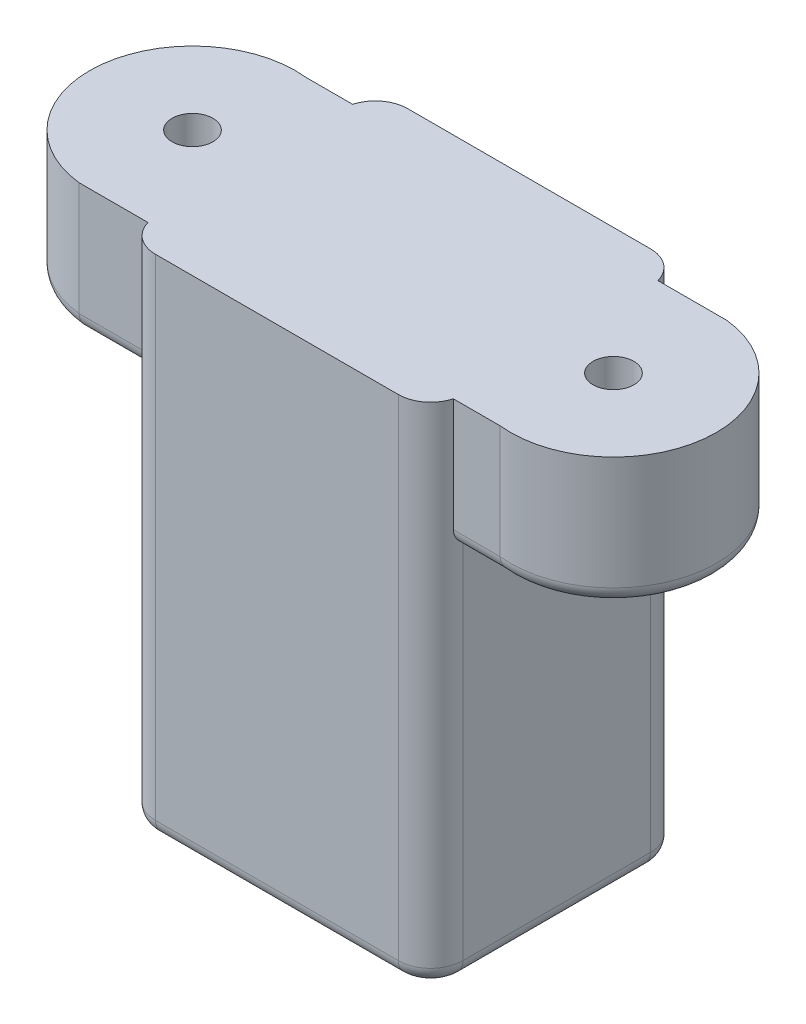
from build123d import *

# Parameters (mm, degrees)
BOSS_EXTRUDE1_DEPTH   = 5.08
M2X0_4_TAPPED_HOLE1_D = 1.6
SKETCH8_W             = 12.065
SKETCH8_H             = 9.8933
BOSS_EXTRUDE2_DEPTH   = 19.8628
FILLET1_R             = 1.27
FILLET2_R             = 0.635
FILLET3_R             = 0.635


with BuildPart() as part:
    # Sketch1 → Boss-Extrude1 (new body)
    with BuildSketch(Plane(origin=(0, 0, 0), x_dir=(1, 0, 0), z_dir=(0, 1, 0))):
        with BuildLine():
            Line((7.823998487, -4.0132), (-8.686001513, -4.0132))
            ThreePointArc((-8.686001513, -4.0132), (-12.2682, 0.431001513), (-7.823998487, 4.0132))
            Line((-7.823998487, 4.0132), (8.686001513, 4.0132))
            ThreePointArc((8.686001513, 4.0132), (12.2682, -0.431001513), (7.823998487, -4.0132))
        make_face()
    extrude(amount=BOSS_EXTRUDE1_DEPTH)

    # M2x0.4 Tapped Hole1 (through all)
    with Locations(Plane(origin=(0, 5.08, 0), x_dir=(1, 0, 0), z_dir=(0, 1, 0))):
        with Locations((-8.255, 0), (8.255, 0)):
            Hole(M2X0_4_TAPPED_HOLE1_D / 2)

    # Sketch8 → Boss-Extrude2 (add)
    with BuildSketch(Plane(origin=(0, 5.08, 0), x_dir=(1, 0, 0), z_dir=(0, 1, 0))):
        Rectangle(SKETCH8_W, SKETCH8_H)
    extrude(amount=-BOSS_EXTRUDE2_DEPTH)

    # Fillet1
    fillet1_edges = [part.edges().sort_by_distance(p)[0] for p in [
        (-6.0325, -4.8514, 4.94665),
        (6.0325, -4.8514, 4.94665),
        (-6.0325, -4.8514, -4.94665),
        (6.0325, -4.8514, -4.94665),
    ]]
    fillet(fillet1_edges, radius=FILLET1_R)

    # Fillet2
    fillet2_edges = [part.edges().sort_by_distance(p)[0] for p in [
        (-7.336548498, 0, 4.0132),
        (-12.2682, 0, -0.431001513),
        (-6.905546985, 0, -4.0132),
        (7.336548498, 0, -4.0132),
        (6.905546985, 0, 4.0132),
        (12.2682, 0, 0.431001513),
    ]]
    fillet(fillet2_edges, radius=FILLET2_R)

    # Fillet3
    fillet3_edges = [part.edges().sort_by_distance(p)[0] for p in [
        (5.660525612, -14.7828, 4.574675612),
        (6.0325, -14.7828, 0),
        (5.660525612, -14.7828, -4.574675612),
        (0, -14.7828, -4.94665),
        (-5.660525612, -14.7828, -4.574675612),
        (-6.0325, -14.7828, 0),
        (-5.660525612, -14.7828, 4.574675612),
        (0, -14.7828, 4.94665),
    ]]
    fillet(fillet3_edges, radius=FILLET3_R)


solid = part.part
